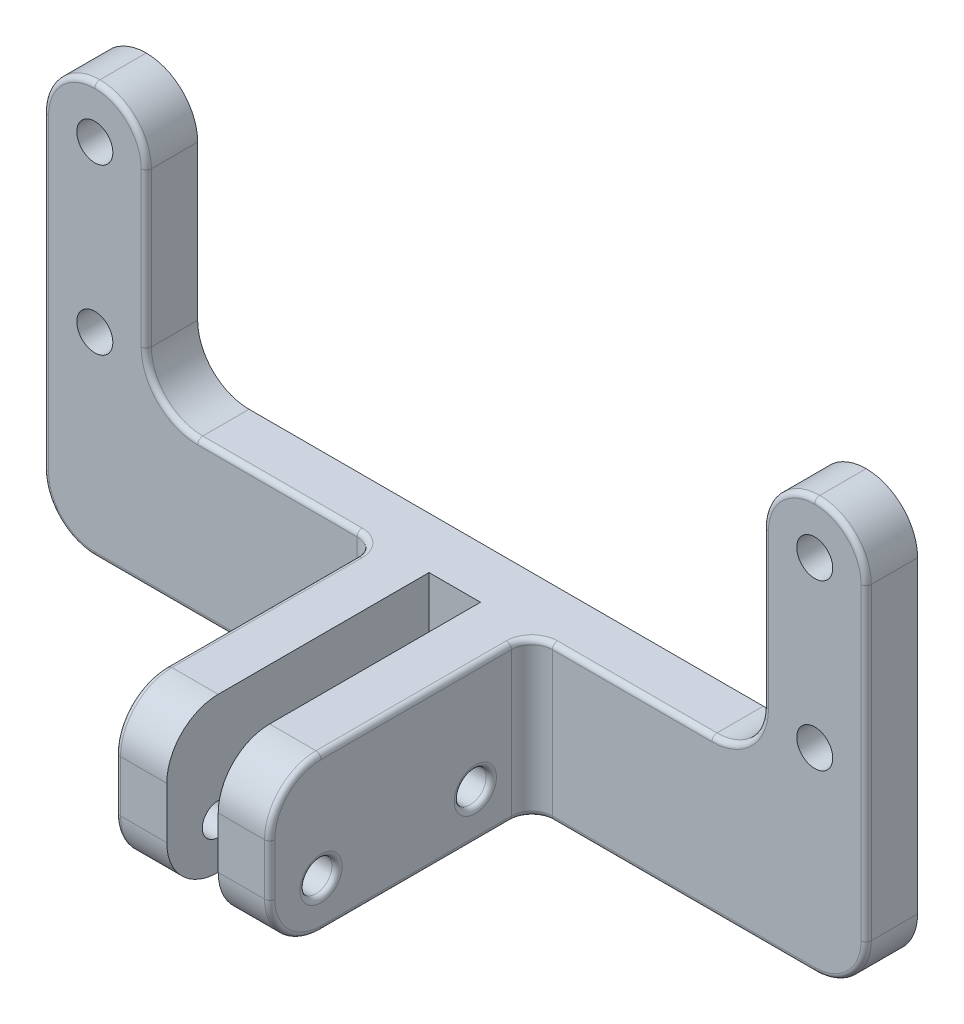
from build123d import *

# Parameters (mm, degrees)
SKETCH_1_W          = 80
SKETCH_1_H          = 40
EXTRUDE_1_DEPTH     = 5
SKETCH_2_R          = 1.75
CUT_EXTRUDE_1_DEPTH = 46
SKETCH_3_W          = 5
SKETCH_3_H          = 15
EXTRUDE_2_DEPTH     = 25.5
SKETCH_4_R          = 1.55
CUT_EXTRUDE_2_DEPTH = 60.887394333
SKETCH_5_W          = 60
SKETCH_5_H          = 25
CUT_EXTRUDE_3_DEPTH = 5
FILLET_1_R          = 5
FILLET_2_R          = 5
FILLET_3_R          = 2
FILLET_4_R          = 0.5


with BuildPart() as part:
    # ｽｹｯﾁ1 → ﾎﾞｽ - 押し出し1 (new body)
    with BuildSketch(Plane.XY):
        Rectangle(SKETCH_1_W, SKETCH_1_H)
    extrude(amount=EXTRUDE_1_DEPTH)

    # ｽｹｯﾁ2 → ｶｯﾄ - 押し出し1 (cut, through all)
    with BuildSketch(Plane.XY):
        with Locations((35, 15)):
            Circle(SKETCH_2_R)
        with Locations((35, -1)):
            Circle(SKETCH_2_R)
        with Locations(Location((-35, 15, 0), (0, 0, 180))):
            Circle(SKETCH_2_R)
        with Locations(Location((-35, -1, 0), (0, 0, 180))):
            Circle(SKETCH_2_R)
    extrude(amount=CUT_EXTRUDE_1_DEPTH, mode=Mode.SUBTRACT)

    # ｽｹｯﾁ3 → ﾎﾞｽ - 押し出し2 (add)
    with BuildSketch(Plane.XY.offset(5)):
        with Locations((5, -12.5)):
            Rectangle(SKETCH_3_W, SKETCH_3_H)
        with Locations((-5, -12.5)):
            Rectangle(SKETCH_3_W, SKETCH_3_H)
    extrude(amount=EXTRUDE_2_DEPTH)

    # ｽｹｯﾁ4 → ｶｯﾄ - 押し出し2 (cut, through all)
    with BuildSketch(Plane.ZY.offset(7.5)):
        with Locations(Location((10.5, -15.5, 0), (0, 0, 90))):
            Circle(SKETCH_4_R)
        with Locations(Location((25.5, -15.5, 0), (0, 0, 90))):
            Circle(SKETCH_4_R)
    extrude(amount=-CUT_EXTRUDE_2_DEPTH, mode=Mode.SUBTRACT)

    # ｽｹｯﾁ5 → ｶｯﾄ - 押し出し3 (cut)
    with BuildSketch(Plane.XY):
        with Locations((0, 7.5)):
            Rectangle(SKETCH_5_W, SKETCH_5_H)
    extrude(amount=CUT_EXTRUDE_3_DEPTH, mode=Mode.SUBTRACT)

    # ﾌｨﾚｯﾄ1
    fillet_1_edges = [part.edges().sort_by_distance(p)[0] for p in [
        (5, -5, 30.5),
        (-5, -5, 30.5),
        (5, -20, 30.5),
        (-5, -20, 30.5),
    ]]
    fillet(fillet_1_edges, radius=FILLET_1_R)

    # ﾌｨﾚｯﾄ2
    fillet_2_edges = [part.edges().sort_by_distance(p)[0] for p in [
        (-30, -5, 2.5),
        (30, -5, 2.5),
        (30, 20, 2.5),
        (40, 20, 2.5),
        (40, -20, 2.5),
        (-40, -20, 2.5),
        (-30, 20, 2.5),
        (-40, 20, 2.5),
    ]]
    fillet(fillet_2_edges, radius=FILLET_2_R - 0.0001)  # a hair under: the kernel refuses the full size

    # ﾌｨﾚｯﾄ3
    fillet_3_edges = [part.edges().sort_by_distance(p)[0] for p in [
        (7.5, -12.5, 5),
        (-7.5, -12.5, 5),
    ]]
    fillet(fillet_3_edges, radius=FILLET_3_R)

    # ﾌｨﾚｯﾄ4
    fillet_4_edges = [part.edges().sort_by_distance(p)[0] for p in [
        (7.5, -6.464466094, 29.035533906),
        (-7.5, -12.5, 30.5),
        (-7.5, -20, 16.25),
        (-7.5, -18.535533906, 29.035533906),
        (-7.5, -6.464466094, 29.035533906),
        (-30, 7.5, 5),
        (-17.25005, -5, 5),
        (30, 7.5, 5),
        (40, 0, 5),
        (38.535563195, -18.535563195, 5),
        (38.535563195, 18.535563195, 5),
        (31.464436805, 18.535563195, 5),
        (-22.25005, -20, 5),
        (-40, 0, 5),
        (-38.535563195, 18.535563195, 5),
        (-31.464436805, 18.535563195, 5),
        (-38.535563195, -18.535563195, 5),
        (-28.535563195, -3.535563195, 5),
        (28.535563195, -3.535563195, 5),
        (17.25005, -5, 5),
        (22.25005, -20, 5),
        (8.085786438, -5, 5.585786438),
        (8.085786438, -20, 5.585786438),
        (-8.085786438, -20, 5.585786438),
        (-8.085786438, -5, 5.585786438),
        (7.5, -17.05, 10.5),
        (-7.5, -17.05, 10.5),
        (7.5, -17.05, 25.5),
        (-7.5, -17.05, 25.5),
        (7.5, -12.5, 30.5),
        (7.5, -5, 16.25),
        (-7.5, -5, 16.25),
        (7.5, -20, 16.25),
        (7.5, -18.535533906, 29.035533906),
    ]]
    fillet(fillet_4_edges, radius=FILLET_4_R)


solid = part.part
